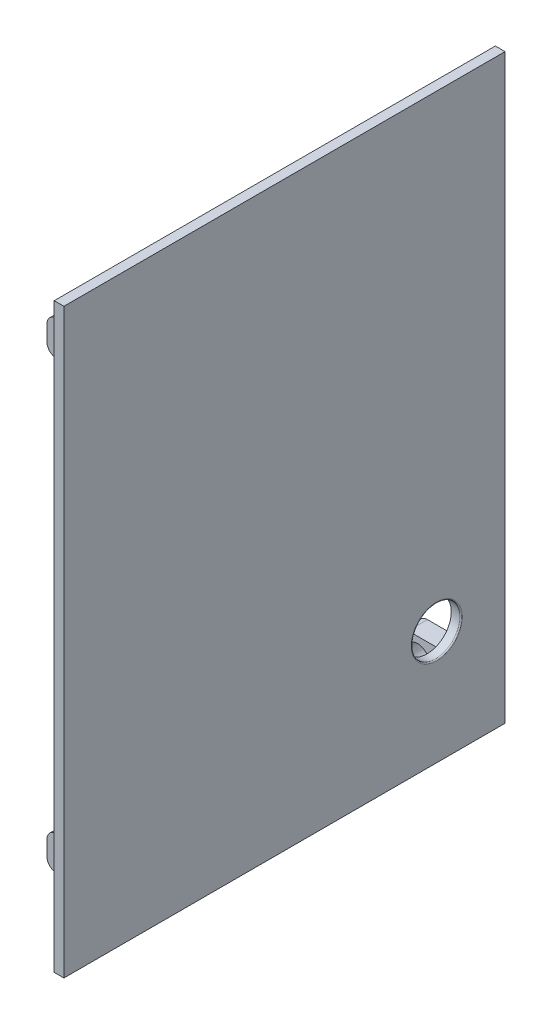
from build123d import *

# Parameters (mm, degrees)
SKETCH3_W               = 90.999999927
SKETCH3_H               = 120.00000252
BOSS_EXTRUDE1_DEPTH     = 2
SKETCH4_R               = 5
CUT_EXTRUDE1_DEPTH      = 152.605067169
FILLET1_R               = 0.25
SKETCH5_W               = 4
SKETCH5_H               = 7.072983346
SKETCH5_H_2             = 7.2
BOSS_EXTRUDE2_DEPTH     = 9
CUT_EXTRUDE2_DEPTH      = 328.052613323
CUT_EXTRUDE2_DEPTH_BACK = 328.052613323
SKETCH6_R               = 2.25
FILLET2_R               = 2


with BuildPart() as part:
    # Sketch3 → Boss-Extrude1 (new body)
    with BuildSketch(Plane(origin=(282.530741059, 0, 0), x_dir=(0, -6.071029670218199e-10, -1.0), z_dir=(1, 0, 0))):
        with Locations((13.262804665, 79.739145611)):
            Rectangle(SKETCH3_W, SKETCH3_H)
    extrude(amount=BOSS_EXTRUDE1_DEPTH)

    # Sketch4 → Cut-Extrude1 (cut, through all)
    with BuildSketch(Plane(origin=(284.530741059, 0, 0), x_dir=(0, 0, -1), z_dir=(1, 0, 0))):
        with Locations((44.667804714, 43.189146835)):
            Circle(SKETCH4_R)
    extrude(amount=-CUT_EXTRUDE1_DEPTH, mode=Mode.SUBTRACT)

    # Fillet1
    fillet1_edges = [part.edges().sort_by_distance(p)[0] for p in [
        (284.530741059, 43.189146835, -39.667804714),
    ]]
    fillet(fillet1_edges, radius=FILLET1_R)

    # Sketch5 → Boss-Extrude2 (add)
    with BuildSketch(Plane.ZY.offset(-282.530741059)):
        with Locations((-49.752804714, 33.739146835)):
            Rectangle(SKETCH5_W, SKETCH5_H)
        with Locations((-50.252804714, 125.739146835)):
            Rectangle(SKETCH5_W, SKETCH5_H_2)
        with Locations((22.737195286, 33.739146835)):
            Rectangle(SKETCH5_W, SKETCH5_H)
        with Locations((22.737195286, 125.739146835)):
            Rectangle(SKETCH5_W, SKETCH5_H_2)
    extrude(amount=BOSS_EXTRUDE2_DEPTH)

    # Sketch6 → Cut-Extrude2 (cut, two sides: drawn at the far end of the back side and taken through both)
    with BuildSketch(Plane.XY.offset(-48.252804714).offset(-CUT_EXTRUDE2_DEPTH_BACK)):
        with Locations((277.530741059, 33.739146835)):
            Circle(SKETCH6_R)
        with Locations((277.530741059, 125.739146835)):
            Circle(SKETCH6_R)
    extrude(amount=CUT_EXTRUDE2_DEPTH + CUT_EXTRUDE2_DEPTH_BACK, mode=Mode.SUBTRACT)

    # Fillet2
    fillet2_edges = [part.edges().sort_by_distance(p)[0] for p in [
        (273.530741059, 129.339146835, -50.252804714),
        (273.530741059, 122.139146835, -50.252804714),
        (273.530741059, 129.339146835, 22.737195286),
        (273.530741059, 122.139146835, 22.737195286),
        (273.530741059, 37.275638508, 22.737195286),
        (273.530741059, 30.202655162, 22.737195286),
        (273.530741059, 37.275638508, -49.752804714),
        (273.530741059, 30.202655162, -49.752804714),
    ]]
    fillet(fillet2_edges, radius=FILLET2_R)


solid = part.part
